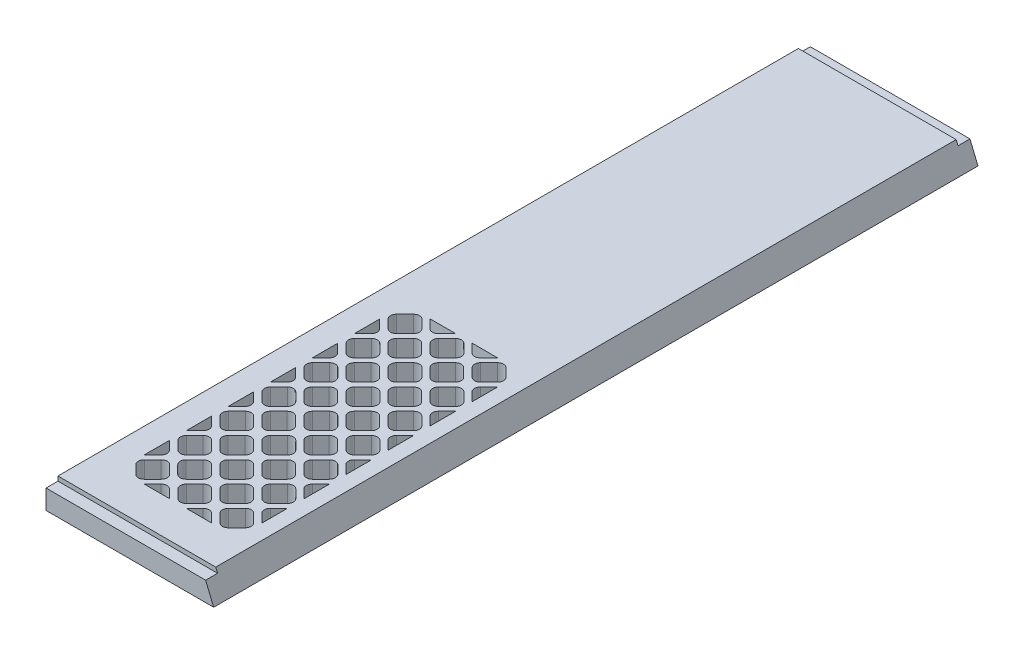
from build123d import *

# Parameters (mm, degrees)
BOSS_EXTRUDE1_DEPTH = 406.4
SKETCH2_W           = 89.154
SKETCH2_H           = 6.35
CUT_EXTRUDE1_DEPTH  = 2.3622
CUT_EXTRUDE3_DEPTH  = 417.257955739


with BuildPart() as part:
    # Sketch1 → Boss-Extrude1 (new body)
    with BuildSketch(Plane.XY):
        Polygon((0, 0), (0, 12.7), (83.893487758, 12.7), (89.154, 0), align=None)
    extrude(amount=BOSS_EXTRUDE1_DEPTH)

    # Sketch2 → Cut-Extrude1 (cut)
    with BuildSketch(Plane.XZ.offset(-12.7)):
        with Locations((44.577, 3.175)):
            Rectangle(SKETCH2_W, SKETCH2_H)
        with Locations((44.577, 403.225)):
            Rectangle(SKETCH2_W, SKETCH2_H)
    extrude(amount=CUT_EXTRUDE1_DEPTH, mode=Mode.SUBTRACT)

    # Sketch3 → Cut-Extrude3 (cut, through all)
    with BuildSketch(Plane.XZ):
        with BuildLine():
            Line((19.97993597, 378.591192091), (15.489807909, 374.10106403))
            ThreePointArc((15.489807909, 374.10106403), (14.559871939, 371.856), (15.489807909, 369.61093597))
            Line((15.489807909, 369.61093597), (19.97993597, 365.120807909))
            ThreePointArc((19.97993597, 365.120807909), (22.225, 364.190871939), (24.47006403, 365.120807909))
            Line((24.47006403, 365.120807909), (28.960192091, 369.61093597))
            ThreePointArc((28.960192091, 369.61093597), (29.890128061, 371.856), (28.960192091, 374.10106403))
            Line((28.960192091, 374.10106403), (24.47006403, 378.591192091))
            ThreePointArc((24.47006403, 378.591192091), (22.225, 379.521128061), (19.97993597, 378.591192091))
        make_face()
        with BuildLine():
            Line((40.086871939, 380.836256121), (26.616487758, 380.836256121))
            Line((26.616487758, 380.836256121), (31.106615818, 376.346128061))
            ThreePointArc((31.106615818, 376.346128061), (33.351679849, 375.416192091), (35.596743879, 376.346128061))
            Line((35.596743879, 376.346128061), (40.086871939, 380.836256121))
        make_face()
        with BuildLine():
            Line((17.734871939, 362.974384182), (13.244743879, 367.464512242))
            Line((13.244743879, 367.464512242), (13.244743879, 353.994128061))
            Line((13.244743879, 353.994128061), (17.734871939, 358.484256121))
            ThreePointArc((17.734871939, 358.484256121), (18.664807909, 360.729320151), (17.734871939, 362.974384182))
        make_face()
        with BuildLine():
            Line((62.438871939, 380.836256121), (48.968487758, 380.836256121))
            Line((48.968487758, 380.836256121), (53.458615818, 376.346128061))
            ThreePointArc((53.458615818, 376.346128061), (55.703679849, 375.416192091), (57.948743879, 376.346128061))
            Line((57.948743879, 376.346128061), (62.438871939, 380.836256121))
        make_face()
        with BuildLine():
            Line((17.734871939, 340.622384182), (13.244743879, 345.112512242))
            Line((13.244743879, 345.112512242), (13.244743879, 331.642128061))
            Line((13.244743879, 331.642128061), (17.734871939, 336.132256121))
            ThreePointArc((17.734871939, 336.132256121), (18.664807909, 338.377320151), (17.734871939, 340.622384182))
        make_face()
        with BuildLine():
            Line((17.734871939, 318.270384182), (13.244743879, 322.760512242))
            Line((13.244743879, 322.760512242), (13.244743879, 309.290128061))
            Line((13.244743879, 309.290128061), (17.734871939, 313.780256121))
            ThreePointArc((17.734871939, 313.780256121), (18.664807909, 316.025320151), (17.734871939, 318.270384182))
        make_face()
        with BuildLine():
            Line((17.734871939, 295.918384182), (13.244743879, 300.408512242))
            Line((13.244743879, 300.408512242), (13.244743879, 286.938128061))
            Line((13.244743879, 286.938128061), (17.734871939, 291.428256121))
            ThreePointArc((17.734871939, 291.428256121), (18.664807909, 293.673320151), (17.734871939, 295.918384182))
        make_face()
        with BuildLine():
            Line((75.909256121, 353.89964295), (75.909256121, 367.558997353))
            ThreePointArc((75.909256121, 367.558997353), (75.859427805, 367.51228531), (75.810615818, 367.464512242))
            Line((75.810615818, 367.464512242), (71.320487758, 362.974384182))
            ThreePointArc((71.320487758, 362.974384182), (70.390551788, 360.729320151), (71.320487758, 358.484256121))
            Line((71.320487758, 358.484256121), (75.810615818, 353.994128061))
            ThreePointArc((75.810615818, 353.994128061), (75.859427805, 353.946354993), (75.909256121, 353.89964295))
        make_face()
        with BuildLine():
            Line((17.734871939, 273.566384182), (13.244743879, 278.056512242))
            Line((13.244743879, 278.056512242), (13.244743879, 264.586128061))
            Line((13.244743879, 264.586128061), (17.734871939, 269.076256121))
            ThreePointArc((17.734871939, 269.076256121), (18.664807909, 271.321320151), (17.734871939, 273.566384182))
        make_face()
        with BuildLine():
            Line((75.909256121, 331.54764295), (75.909256121, 345.206997353))
            ThreePointArc((75.909256121, 345.206997353), (75.859427805, 345.16028531), (75.810615818, 345.112512242))
            Line((75.810615818, 345.112512242), (71.320487758, 340.622384182))
            ThreePointArc((71.320487758, 340.622384182), (70.390551788, 338.377320151), (71.320487758, 336.132256121))
            Line((71.320487758, 336.132256121), (75.810615818, 331.642128061))
            ThreePointArc((75.810615818, 331.642128061), (75.859427805, 331.594354993), (75.909256121, 331.54764295))
        make_face()
        with BuildLine():
            Line((17.734871939, 251.214384182), (13.244743879, 255.704512242))
            Line((13.244743879, 255.704512242), (13.244743879, 242.234128061))
            Line((13.244743879, 242.234128061), (17.734871939, 246.724256121))
            ThreePointArc((17.734871939, 246.724256121), (18.664807909, 248.969320151), (17.734871939, 251.214384182))
        make_face()
        with BuildLine():
            Line((75.909256121, 309.19564295), (75.909256121, 322.854997353))
            ThreePointArc((75.909256121, 322.854997353), (75.859427805, 322.80828531), (75.810615818, 322.760512242))
            Line((75.810615818, 322.760512242), (71.320487758, 318.270384182))
            ThreePointArc((71.320487758, 318.270384182), (70.390551788, 316.025320151), (71.320487758, 313.780256121))
            Line((71.320487758, 313.780256121), (75.810615818, 309.290128061))
            ThreePointArc((75.810615818, 309.290128061), (75.859427805, 309.242354993), (75.909256121, 309.19564295))
        make_face()
        with BuildLine():
            Line((75.909256121, 286.84364295), (75.909256121, 300.502997353))
            ThreePointArc((75.909256121, 300.502997353), (75.859427805, 300.45628531), (75.810615818, 300.408512242))
            Line((75.810615818, 300.408512242), (71.320487758, 295.918384182))
            ThreePointArc((71.320487758, 295.918384182), (70.390551788, 293.673320151), (71.320487758, 291.428256121))
            Line((71.320487758, 291.428256121), (75.810615818, 286.938128061))
            ThreePointArc((75.810615818, 286.938128061), (75.859427805, 286.890354993), (75.909256121, 286.84364295))
        make_face()
        with BuildLine():
            Line((75.909256121, 264.49164295), (75.909256121, 278.150997353))
            ThreePointArc((75.909256121, 278.150997353), (75.859427805, 278.10428531), (75.810615818, 278.056512242))
            Line((75.810615818, 278.056512242), (71.320487758, 273.566384182))
            ThreePointArc((71.320487758, 273.566384182), (70.390551788, 271.321320151), (71.320487758, 269.076256121))
            Line((71.320487758, 269.076256121), (75.810615818, 264.586128061))
            ThreePointArc((75.810615818, 264.586128061), (75.859427805, 264.538354993), (75.909256121, 264.49164295))
        make_face()
        with BuildLine():
            ThreePointArc((26.616487758, 228.862384182), (26.56871469, 228.813572195), (26.522002647, 228.763743879))
            Line((26.522002647, 228.763743879), (40.18135705, 228.763743879))
            ThreePointArc((40.18135705, 228.763743879), (40.134645007, 228.813572195), (40.086871939, 228.862384182))
            Line((40.086871939, 228.862384182), (35.596743879, 233.352512242))
            ThreePointArc((35.596743879, 233.352512242), (33.351679849, 234.282448212), (31.106615818, 233.352512242))
            Line((31.106615818, 233.352512242), (26.616487758, 228.862384182))
        make_face()
        with BuildLine():
            Line((75.909256121, 242.13964295), (75.909256121, 255.798997353))
            ThreePointArc((75.909256121, 255.798997353), (75.859427805, 255.75228531), (75.810615818, 255.704512242))
            Line((75.810615818, 255.704512242), (71.320487758, 251.214384182))
            ThreePointArc((71.320487758, 251.214384182), (70.390551788, 248.969320151), (71.320487758, 246.724256121))
            Line((71.320487758, 246.724256121), (75.810615818, 242.234128061))
            ThreePointArc((75.810615818, 242.234128061), (75.859427805, 242.186354993), (75.909256121, 242.13964295))
        make_face()
        with BuildLine():
            ThreePointArc((48.968487758, 228.862384182), (48.92071469, 228.813572195), (48.874002647, 228.763743879))
            Line((48.874002647, 228.763743879), (62.53335705, 228.763743879))
            ThreePointArc((62.53335705, 228.763743879), (62.486645007, 228.813572195), (62.438871939, 228.862384182))
            Line((62.438871939, 228.862384182), (57.948743879, 233.352512242))
            ThreePointArc((57.948743879, 233.352512242), (55.703679849, 234.282448212), (53.458615818, 233.352512242))
            Line((53.458615818, 233.352512242), (48.968487758, 228.862384182))
        make_face()
        with BuildLine():
            Line((37.841807909, 369.61093597), (42.33193597, 365.120807909))
            ThreePointArc((42.33193597, 365.120807909), (44.577, 364.190871939), (46.82206403, 365.120807909))
            Line((46.82206403, 365.120807909), (51.312192091, 369.61093597))
            ThreePointArc((51.312192091, 369.61093597), (52.242128061, 371.856), (51.312192091, 374.10106403))
            Line((51.312192091, 374.10106403), (46.82206403, 378.591192091))
            ThreePointArc((46.82206403, 378.591192091), (44.577, 379.521128061), (42.33193597, 378.591192091))
            Line((42.33193597, 378.591192091), (37.841807909, 374.10106403))
            ThreePointArc((37.841807909, 374.10106403), (36.911871939, 371.856), (37.841807909, 369.61093597))
        make_face()
        with BuildLine():
            Line((60.193807909, 369.61093597), (64.68393597, 365.120807909))
            ThreePointArc((64.68393597, 365.120807909), (66.929, 364.190871939), (69.17406403, 365.120807909))
            Line((69.17406403, 365.120807909), (73.664192091, 369.61093597))
            ThreePointArc((73.664192091, 369.61093597), (74.594128061, 371.856), (73.664192091, 374.10106403))
            Line((73.664192091, 374.10106403), (69.17406403, 378.591192091))
            ThreePointArc((69.17406403, 378.591192091), (66.929, 379.521128061), (64.68393597, 378.591192091))
            Line((64.68393597, 378.591192091), (60.193807909, 374.10106403))
            ThreePointArc((60.193807909, 374.10106403), (59.263871939, 371.856), (60.193807909, 369.61093597))
        make_face()
        with BuildLine():
            Line((15.489807909, 347.25893597), (19.97993597, 342.768807909))
            ThreePointArc((19.97993597, 342.768807909), (22.225, 341.838871939), (24.47006403, 342.768807909))
            Line((24.47006403, 342.768807909), (28.960192091, 347.25893597))
            ThreePointArc((28.960192091, 347.25893597), (29.890128061, 349.504), (28.960192091, 351.74906403))
            Line((28.960192091, 351.74906403), (24.47006403, 356.239192091))
            ThreePointArc((24.47006403, 356.239192091), (22.225, 357.169128061), (19.97993597, 356.239192091))
            Line((19.97993597, 356.239192091), (15.489807909, 351.74906403))
            ThreePointArc((15.489807909, 351.74906403), (14.559871939, 349.504), (15.489807909, 347.25893597))
        make_face()
        with BuildLine():
            Line((37.841807909, 347.25893597), (42.33193597, 342.768807909))
            ThreePointArc((42.33193597, 342.768807909), (44.577, 341.838871939), (46.82206403, 342.768807909))
            Line((46.82206403, 342.768807909), (51.312192091, 347.25893597))
            ThreePointArc((51.312192091, 347.25893597), (52.242128061, 349.504), (51.312192091, 351.74906403))
            Line((51.312192091, 351.74906403), (46.82206403, 356.239192091))
            ThreePointArc((46.82206403, 356.239192091), (44.577, 357.169128061), (42.33193597, 356.239192091))
            Line((42.33193597, 356.239192091), (37.841807909, 351.74906403))
            ThreePointArc((37.841807909, 351.74906403), (36.911871939, 349.504), (37.841807909, 347.25893597))
        make_face()
        with BuildLine():
            Line((60.193807909, 347.25893597), (64.68393597, 342.768807909))
            ThreePointArc((64.68393597, 342.768807909), (66.929, 341.838871939), (69.17406403, 342.768807909))
            Line((69.17406403, 342.768807909), (73.664192091, 347.25893597))
            ThreePointArc((73.664192091, 347.25893597), (74.594128061, 349.504), (73.664192091, 351.74906403))
            Line((73.664192091, 351.74906403), (69.17406403, 356.239192091))
            ThreePointArc((69.17406403, 356.239192091), (66.929, 357.169128061), (64.68393597, 356.239192091))
            Line((64.68393597, 356.239192091), (60.193807909, 351.74906403))
            ThreePointArc((60.193807909, 351.74906403), (59.263871939, 349.504), (60.193807909, 347.25893597))
        make_face()
        with BuildLine():
            Line((15.489807909, 324.90693597), (19.97993597, 320.416807909))
            ThreePointArc((19.97993597, 320.416807909), (22.225, 319.486871939), (24.47006403, 320.416807909))
            Line((24.47006403, 320.416807909), (28.960192091, 324.90693597))
            ThreePointArc((28.960192091, 324.90693597), (29.890128061, 327.152), (28.960192091, 329.39706403))
            Line((28.960192091, 329.39706403), (24.47006403, 333.887192091))
            ThreePointArc((24.47006403, 333.887192091), (22.225, 334.817128061), (19.97993597, 333.887192091))
            Line((19.97993597, 333.887192091), (15.489807909, 329.39706403))
            ThreePointArc((15.489807909, 329.39706403), (14.559871939, 327.152), (15.489807909, 324.90693597))
        make_face()
        with BuildLine():
            Line((37.841807909, 324.90693597), (42.33193597, 320.416807909))
            ThreePointArc((42.33193597, 320.416807909), (44.577, 319.486871939), (46.82206403, 320.416807909))
            Line((46.82206403, 320.416807909), (51.312192091, 324.90693597))
            ThreePointArc((51.312192091, 324.90693597), (52.242128061, 327.152), (51.312192091, 329.39706403))
            Line((51.312192091, 329.39706403), (46.82206403, 333.887192091))
            ThreePointArc((46.82206403, 333.887192091), (44.577, 334.817128061), (42.33193597, 333.887192091))
            Line((42.33193597, 333.887192091), (37.841807909, 329.39706403))
            ThreePointArc((37.841807909, 329.39706403), (36.911871939, 327.152), (37.841807909, 324.90693597))
        make_face()
        with BuildLine():
            Line((60.193807909, 324.90693597), (64.68393597, 320.416807909))
            ThreePointArc((64.68393597, 320.416807909), (66.929, 319.486871939), (69.17406403, 320.416807909))
            Line((69.17406403, 320.416807909), (73.664192091, 324.90693597))
            ThreePointArc((73.664192091, 324.90693597), (74.594128061, 327.152), (73.664192091, 329.39706403))
            Line((73.664192091, 329.39706403), (69.17406403, 333.887192091))
            ThreePointArc((69.17406403, 333.887192091), (66.929, 334.817128061), (64.68393597, 333.887192091))
            Line((64.68393597, 333.887192091), (60.193807909, 329.39706403))
            ThreePointArc((60.193807909, 329.39706403), (59.263871939, 327.152), (60.193807909, 324.90693597))
        make_face()
        with BuildLine():
            Line((15.489807909, 302.55493597), (19.97993597, 298.064807909))
            ThreePointArc((19.97993597, 298.064807909), (22.225, 297.134871939), (24.47006403, 298.064807909))
            Line((24.47006403, 298.064807909), (28.960192091, 302.55493597))
            ThreePointArc((28.960192091, 302.55493597), (29.890128061, 304.8), (28.960192091, 307.04506403))
            Line((28.960192091, 307.04506403), (24.47006403, 311.535192091))
            ThreePointArc((24.47006403, 311.535192091), (22.225, 312.465128061), (19.97993597, 311.535192091))
            Line((19.97993597, 311.535192091), (15.489807909, 307.04506403))
            ThreePointArc((15.489807909, 307.04506403), (14.559871939, 304.8), (15.489807909, 302.55493597))
        make_face()
        with BuildLine():
            Line((37.841807909, 302.55493597), (42.33193597, 298.064807909))
            ThreePointArc((42.33193597, 298.064807909), (44.577, 297.134871939), (46.82206403, 298.064807909))
            Line((46.82206403, 298.064807909), (51.312192091, 302.55493597))
            ThreePointArc((51.312192091, 302.55493597), (52.242128061, 304.8), (51.312192091, 307.04506403))
            Line((51.312192091, 307.04506403), (46.82206403, 311.535192091))
            ThreePointArc((46.82206403, 311.535192091), (44.577, 312.465128061), (42.33193597, 311.535192091))
            Line((42.33193597, 311.535192091), (37.841807909, 307.04506403))
            ThreePointArc((37.841807909, 307.04506403), (36.911871939, 304.8), (37.841807909, 302.55493597))
        make_face()
        with BuildLine():
            Line((60.193807909, 302.55493597), (64.68393597, 298.064807909))
            ThreePointArc((64.68393597, 298.064807909), (66.929, 297.134871939), (69.17406403, 298.064807909))
            Line((69.17406403, 298.064807909), (73.664192091, 302.55493597))
            ThreePointArc((73.664192091, 302.55493597), (74.594128061, 304.8), (73.664192091, 307.04506403))
            Line((73.664192091, 307.04506403), (69.17406403, 311.535192091))
            ThreePointArc((69.17406403, 311.535192091), (66.929, 312.465128061), (64.68393597, 311.535192091))
            Line((64.68393597, 311.535192091), (60.193807909, 307.04506403))
            ThreePointArc((60.193807909, 307.04506403), (59.263871939, 304.8), (60.193807909, 302.55493597))
        make_face()
        with BuildLine():
            Line((15.489807909, 280.20293597), (19.97993597, 275.712807909))
            ThreePointArc((19.97993597, 275.712807909), (22.225, 274.782871939), (24.47006403, 275.712807909))
            Line((24.47006403, 275.712807909), (28.960192091, 280.20293597))
            ThreePointArc((28.960192091, 280.20293597), (29.890128061, 282.448), (28.960192091, 284.69306403))
            Line((28.960192091, 284.69306403), (24.47006403, 289.183192091))
            ThreePointArc((24.47006403, 289.183192091), (22.225, 290.113128061), (19.97993597, 289.183192091))
            Line((19.97993597, 289.183192091), (15.489807909, 284.69306403))
            ThreePointArc((15.489807909, 284.69306403), (14.559871939, 282.448), (15.489807909, 280.20293597))
        make_face()
        with BuildLine():
            Line((37.841807909, 280.20293597), (42.33193597, 275.712807909))
            ThreePointArc((42.33193597, 275.712807909), (44.577, 274.782871939), (46.82206403, 275.712807909))
            Line((46.82206403, 275.712807909), (51.312192091, 280.20293597))
            ThreePointArc((51.312192091, 280.20293597), (52.242128061, 282.448), (51.312192091, 284.69306403))
            Line((51.312192091, 284.69306403), (46.82206403, 289.183192091))
            ThreePointArc((46.82206403, 289.183192091), (44.577, 290.113128061), (42.33193597, 289.183192091))
            Line((42.33193597, 289.183192091), (37.841807909, 284.69306403))
            ThreePointArc((37.841807909, 284.69306403), (36.911871939, 282.448), (37.841807909, 280.20293597))
        make_face()
        with BuildLine():
            Line((60.193807909, 280.20293597), (64.68393597, 275.712807909))
            ThreePointArc((64.68393597, 275.712807909), (66.929, 274.782871939), (69.17406403, 275.712807909))
            Line((69.17406403, 275.712807909), (73.664192091, 280.20293597))
            ThreePointArc((73.664192091, 280.20293597), (74.594128061, 282.448), (73.664192091, 284.69306403))
            Line((73.664192091, 284.69306403), (69.17406403, 289.183192091))
            ThreePointArc((69.17406403, 289.183192091), (66.929, 290.113128061), (64.68393597, 289.183192091))
            Line((64.68393597, 289.183192091), (60.193807909, 284.69306403))
            ThreePointArc((60.193807909, 284.69306403), (59.263871939, 282.448), (60.193807909, 280.20293597))
        make_face()
        with BuildLine():
            Line((15.489807909, 257.85093597), (19.97993597, 253.360807909))
            ThreePointArc((19.97993597, 253.360807909), (22.225, 252.430871939), (24.47006403, 253.360807909))
            Line((24.47006403, 253.360807909), (28.960192091, 257.85093597))
            ThreePointArc((28.960192091, 257.85093597), (29.890128061, 260.096), (28.960192091, 262.34106403))
            Line((28.960192091, 262.34106403), (24.47006403, 266.831192091))
            ThreePointArc((24.47006403, 266.831192091), (22.225, 267.761128061), (19.97993597, 266.831192091))
            Line((19.97993597, 266.831192091), (15.489807909, 262.34106403))
            ThreePointArc((15.489807909, 262.34106403), (14.559871939, 260.096), (15.489807909, 257.85093597))
        make_face()
        with BuildLine():
            Line((37.841807909, 257.85093597), (42.33193597, 253.360807909))
            ThreePointArc((42.33193597, 253.360807909), (44.577, 252.430871939), (46.82206403, 253.360807909))
            Line((46.82206403, 253.360807909), (51.312192091, 257.85093597))
            ThreePointArc((51.312192091, 257.85093597), (52.242128061, 260.096), (51.312192091, 262.34106403))
            Line((51.312192091, 262.34106403), (46.82206403, 266.831192091))
            ThreePointArc((46.82206403, 266.831192091), (44.577, 267.761128061), (42.33193597, 266.831192091))
            Line((42.33193597, 266.831192091), (37.841807909, 262.34106403))
            ThreePointArc((37.841807909, 262.34106403), (36.911871939, 260.096), (37.841807909, 257.85093597))
        make_face()
        with BuildLine():
            Line((60.193807909, 257.85093597), (64.68393597, 253.360807909))
            ThreePointArc((64.68393597, 253.360807909), (66.929, 252.430871939), (69.17406403, 253.360807909))
            Line((69.17406403, 253.360807909), (73.664192091, 257.85093597))
            ThreePointArc((73.664192091, 257.85093597), (74.594128061, 260.096), (73.664192091, 262.34106403))
            Line((73.664192091, 262.34106403), (69.17406403, 266.831192091))
            ThreePointArc((69.17406403, 266.831192091), (66.929, 267.761128061), (64.68393597, 266.831192091))
            Line((64.68393597, 266.831192091), (60.193807909, 262.34106403))
            ThreePointArc((60.193807909, 262.34106403), (59.263871939, 260.096), (60.193807909, 257.85093597))
        make_face()
        with BuildLine():
            Line((15.489807909, 235.49893597), (19.97993597, 231.008807909))
            ThreePointArc((19.97993597, 231.008807909), (22.225, 230.078871939), (24.47006403, 231.008807909))
            Line((24.47006403, 231.008807909), (28.960192091, 235.49893597))
            ThreePointArc((28.960192091, 235.49893597), (29.890128061, 237.744), (28.960192091, 239.98906403))
            Line((28.960192091, 239.98906403), (24.47006403, 244.479192091))
            ThreePointArc((24.47006403, 244.479192091), (22.225, 245.409128061), (19.97993597, 244.479192091))
            Line((19.97993597, 244.479192091), (15.489807909, 239.98906403))
            ThreePointArc((15.489807909, 239.98906403), (14.559871939, 237.744), (15.489807909, 235.49893597))
        make_face()
        with BuildLine():
            Line((37.841807909, 235.49893597), (42.33193597, 231.008807909))
            ThreePointArc((42.33193597, 231.008807909), (44.577, 230.078871939), (46.82206403, 231.008807909))
            Line((46.82206403, 231.008807909), (51.312192091, 235.49893597))
            ThreePointArc((51.312192091, 235.49893597), (52.242128061, 237.744), (51.312192091, 239.98906403))
            Line((51.312192091, 239.98906403), (46.82206403, 244.479192091))
            ThreePointArc((46.82206403, 244.479192091), (44.577, 245.409128061), (42.33193597, 244.479192091))
            Line((42.33193597, 244.479192091), (37.841807909, 239.98906403))
            ThreePointArc((37.841807909, 239.98906403), (36.911871939, 237.744), (37.841807909, 235.49893597))
        make_face()
        with BuildLine():
            Line((60.193807909, 235.49893597), (64.68393597, 231.008807909))
            ThreePointArc((64.68393597, 231.008807909), (66.929, 230.078871939), (69.17406403, 231.008807909))
            Line((69.17406403, 231.008807909), (73.664192091, 235.49893597))
            ThreePointArc((73.664192091, 235.49893597), (74.594128061, 237.744), (73.664192091, 239.98906403))
            Line((73.664192091, 239.98906403), (69.17406403, 244.479192091))
            ThreePointArc((69.17406403, 244.479192091), (66.929, 245.409128061), (64.68393597, 244.479192091))
            Line((64.68393597, 244.479192091), (60.193807909, 239.98906403))
            ThreePointArc((60.193807909, 239.98906403), (59.263871939, 237.744), (60.193807909, 235.49893597))
        make_face()
        with BuildLine():
            Line((31.106615818, 367.464512242), (26.616487758, 362.974384182))
            ThreePointArc((26.616487758, 362.974384182), (25.686551788, 360.729320151), (26.616487758, 358.484256121))
            Line((26.616487758, 358.484256121), (31.106615818, 353.994128061))
            ThreePointArc((31.106615818, 353.994128061), (33.351679849, 353.064192091), (35.596743879, 353.994128061))
            Line((35.596743879, 353.994128061), (40.086871939, 358.484256121))
            ThreePointArc((40.086871939, 358.484256121), (41.016807909, 360.729320151), (40.086871939, 362.974384182))
            Line((40.086871939, 362.974384182), (35.596743879, 367.464512242))
            ThreePointArc((35.596743879, 367.464512242), (33.351679849, 368.394448212), (31.106615818, 367.464512242))
        make_face()
        with BuildLine():
            Line((53.458615818, 367.464512242), (48.968487758, 362.974384182))
            ThreePointArc((48.968487758, 362.974384182), (48.038551788, 360.729320151), (48.968487758, 358.484256121))
            Line((48.968487758, 358.484256121), (53.458615818, 353.994128061))
            ThreePointArc((53.458615818, 353.994128061), (55.703679849, 353.064192091), (57.948743879, 353.994128061))
            Line((57.948743879, 353.994128061), (62.438871939, 358.484256121))
            ThreePointArc((62.438871939, 358.484256121), (63.368807909, 360.729320151), (62.438871939, 362.974384182))
            Line((62.438871939, 362.974384182), (57.948743879, 367.464512242))
            ThreePointArc((57.948743879, 367.464512242), (55.703679849, 368.394448212), (53.458615818, 367.464512242))
        make_face()
        with BuildLine():
            Line((31.106615818, 345.112512242), (26.616487758, 340.622384182))
            ThreePointArc((26.616487758, 340.622384182), (25.686551788, 338.377320151), (26.616487758, 336.132256121))
            Line((26.616487758, 336.132256121), (31.106615818, 331.642128061))
            ThreePointArc((31.106615818, 331.642128061), (33.351679849, 330.712192091), (35.596743879, 331.642128061))
            Line((35.596743879, 331.642128061), (40.086871939, 336.132256121))
            ThreePointArc((40.086871939, 336.132256121), (41.016807909, 338.377320151), (40.086871939, 340.622384182))
            Line((40.086871939, 340.622384182), (35.596743879, 345.112512242))
            ThreePointArc((35.596743879, 345.112512242), (33.351679849, 346.042448212), (31.106615818, 345.112512242))
        make_face()
        with BuildLine():
            Line((53.458615818, 345.112512242), (48.968487758, 340.622384182))
            ThreePointArc((48.968487758, 340.622384182), (48.038551788, 338.377320151), (48.968487758, 336.132256121))
            Line((48.968487758, 336.132256121), (53.458615818, 331.642128061))
            ThreePointArc((53.458615818, 331.642128061), (55.703679849, 330.712192091), (57.948743879, 331.642128061))
            Line((57.948743879, 331.642128061), (62.438871939, 336.132256121))
            ThreePointArc((62.438871939, 336.132256121), (63.368807909, 338.377320151), (62.438871939, 340.622384182))
            Line((62.438871939, 340.622384182), (57.948743879, 345.112512242))
            ThreePointArc((57.948743879, 345.112512242), (55.703679849, 346.042448212), (53.458615818, 345.112512242))
        make_face()
        with BuildLine():
            Line((31.106615818, 322.760512242), (26.616487758, 318.270384182))
            ThreePointArc((26.616487758, 318.270384182), (25.686551788, 316.025320151), (26.616487758, 313.780256121))
            Line((26.616487758, 313.780256121), (31.106615818, 309.290128061))
            ThreePointArc((31.106615818, 309.290128061), (33.351679849, 308.360192091), (35.596743879, 309.290128061))
            Line((35.596743879, 309.290128061), (40.086871939, 313.780256121))
            ThreePointArc((40.086871939, 313.780256121), (41.016807909, 316.025320151), (40.086871939, 318.270384182))
            Line((40.086871939, 318.270384182), (35.596743879, 322.760512242))
            ThreePointArc((35.596743879, 322.760512242), (33.351679849, 323.690448212), (31.106615818, 322.760512242))
        make_face()
        with BuildLine():
            Line((53.458615818, 322.760512242), (48.968487758, 318.270384182))
            ThreePointArc((48.968487758, 318.270384182), (48.038551788, 316.025320151), (48.968487758, 313.780256121))
            Line((48.968487758, 313.780256121), (53.458615818, 309.290128061))
            ThreePointArc((53.458615818, 309.290128061), (55.703679849, 308.360192091), (57.948743879, 309.290128061))
            Line((57.948743879, 309.290128061), (62.438871939, 313.780256121))
            ThreePointArc((62.438871939, 313.780256121), (63.368807909, 316.025320151), (62.438871939, 318.270384182))
            Line((62.438871939, 318.270384182), (57.948743879, 322.760512242))
            ThreePointArc((57.948743879, 322.760512242), (55.703679849, 323.690448212), (53.458615818, 322.760512242))
        make_face()
        with BuildLine():
            Line((31.106615818, 300.408512242), (26.616487758, 295.918384182))
            ThreePointArc((26.616487758, 295.918384182), (25.686551788, 293.673320151), (26.616487758, 291.428256121))
            Line((26.616487758, 291.428256121), (31.106615818, 286.938128061))
            ThreePointArc((31.106615818, 286.938128061), (33.351679849, 286.008192091), (35.596743879, 286.938128061))
            Line((35.596743879, 286.938128061), (40.086871939, 291.428256121))
            ThreePointArc((40.086871939, 291.428256121), (41.016807909, 293.673320151), (40.086871939, 295.918384182))
            Line((40.086871939, 295.918384182), (35.596743879, 300.408512242))
            ThreePointArc((35.596743879, 300.408512242), (33.351679849, 301.338448212), (31.106615818, 300.408512242))
        make_face()
        with BuildLine():
            Line((53.458615818, 300.408512242), (48.968487758, 295.918384182))
            ThreePointArc((48.968487758, 295.918384182), (48.038551788, 293.673320151), (48.968487758, 291.428256121))
            Line((48.968487758, 291.428256121), (53.458615818, 286.938128061))
            ThreePointArc((53.458615818, 286.938128061), (55.703679849, 286.008192091), (57.948743879, 286.938128061))
            Line((57.948743879, 286.938128061), (62.438871939, 291.428256121))
            ThreePointArc((62.438871939, 291.428256121), (63.368807909, 293.673320151), (62.438871939, 295.918384182))
            Line((62.438871939, 295.918384182), (57.948743879, 300.408512242))
            ThreePointArc((57.948743879, 300.408512242), (55.703679849, 301.338448212), (53.458615818, 300.408512242))
        make_face()
        with BuildLine():
            Line((31.106615818, 278.056512242), (26.616487758, 273.566384182))
            ThreePointArc((26.616487758, 273.566384182), (25.686551788, 271.321320151), (26.616487758, 269.076256121))
            Line((26.616487758, 269.076256121), (31.106615818, 264.586128061))
            ThreePointArc((31.106615818, 264.586128061), (33.351679849, 263.656192091), (35.596743879, 264.586128061))
            Line((35.596743879, 264.586128061), (40.086871939, 269.076256121))
            ThreePointArc((40.086871939, 269.076256121), (41.016807909, 271.321320151), (40.086871939, 273.566384182))
            Line((40.086871939, 273.566384182), (35.596743879, 278.056512242))
            ThreePointArc((35.596743879, 278.056512242), (33.351679849, 278.986448212), (31.106615818, 278.056512242))
        make_face()
        with BuildLine():
            Line((53.458615818, 278.056512242), (48.968487758, 273.566384182))
            ThreePointArc((48.968487758, 273.566384182), (48.038551788, 271.321320151), (48.968487758, 269.076256121))
            Line((48.968487758, 269.076256121), (53.458615818, 264.586128061))
            ThreePointArc((53.458615818, 264.586128061), (55.703679849, 263.656192091), (57.948743879, 264.586128061))
            Line((57.948743879, 264.586128061), (62.438871939, 269.076256121))
            ThreePointArc((62.438871939, 269.076256121), (63.368807909, 271.321320151), (62.438871939, 273.566384182))
            Line((62.438871939, 273.566384182), (57.948743879, 278.056512242))
            ThreePointArc((57.948743879, 278.056512242), (55.703679849, 278.986448212), (53.458615818, 278.056512242))
        make_face()
        with BuildLine():
            Line((31.106615818, 255.704512242), (26.616487758, 251.214384182))
            ThreePointArc((26.616487758, 251.214384182), (25.686551788, 248.969320151), (26.616487758, 246.724256121))
            Line((26.616487758, 246.724256121), (31.106615818, 242.234128061))
            ThreePointArc((31.106615818, 242.234128061), (33.351679849, 241.304192091), (35.596743879, 242.234128061))
            Line((35.596743879, 242.234128061), (40.086871939, 246.724256121))
            ThreePointArc((40.086871939, 246.724256121), (41.016807909, 248.969320151), (40.086871939, 251.214384182))
            Line((40.086871939, 251.214384182), (35.596743879, 255.704512242))
            ThreePointArc((35.596743879, 255.704512242), (33.351679849, 256.634448212), (31.106615818, 255.704512242))
        make_face()
        with BuildLine():
            Line((53.458615818, 255.704512242), (48.968487758, 251.214384182))
            ThreePointArc((48.968487758, 251.214384182), (48.038551788, 248.969320151), (48.968487758, 246.724256121))
            Line((48.968487758, 246.724256121), (53.458615818, 242.234128061))
            ThreePointArc((53.458615818, 242.234128061), (55.703679849, 241.304192091), (57.948743879, 242.234128061))
            Line((57.948743879, 242.234128061), (62.438871939, 246.724256121))
            ThreePointArc((62.438871939, 246.724256121), (63.368807909, 248.969320151), (62.438871939, 251.214384182))
            Line((62.438871939, 251.214384182), (57.948743879, 255.704512242))
            ThreePointArc((57.948743879, 255.704512242), (55.703679849, 256.634448212), (53.458615818, 255.704512242))
        make_face()
    extrude(amount=-CUT_EXTRUDE3_DEPTH, mode=Mode.SUBTRACT)


solid = part.part
